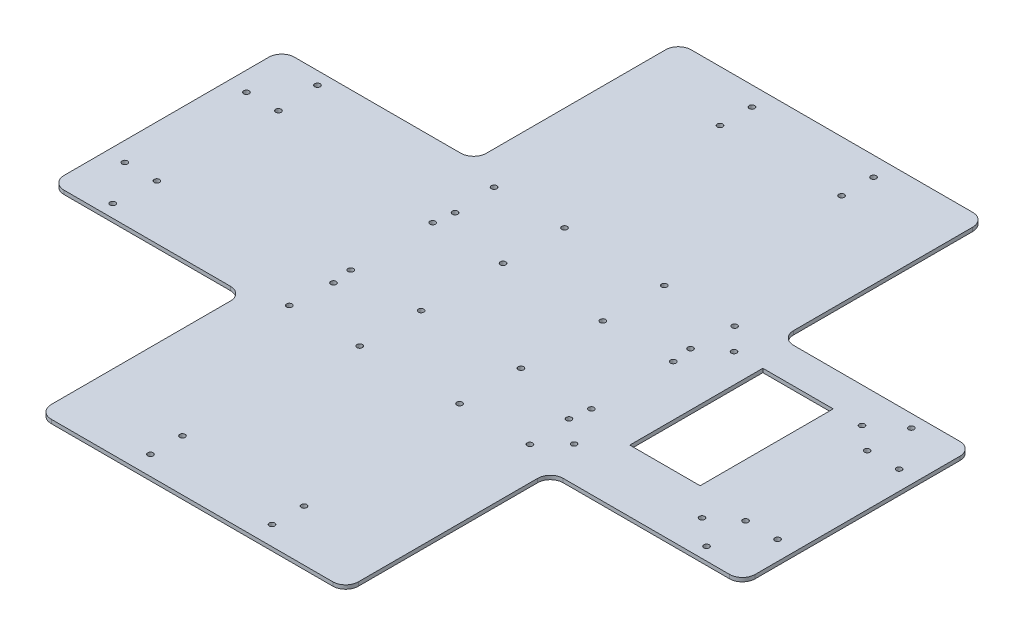
from build123d import *

# Parameters (mm, degrees)
BASE_DEPTH               = 3
FILLET1_R                = 10
SKETCH2_R                = 2.125
ARMOR_MODULE_HOLES_DEPTH = 3
SKETCH3_R                = 2.125
PLATES_FOR_GIMBAL_DEPTH  = 3
SKETCH6_R                = 2.125
SKETCH6_W                = 55
SKETCH6_H                = 104
BATTERY_MOUNT_DEPTH      = 10
SKETCH5_R                = 2.125
SUSPENSION_MOUNT_DEPTH   = 10
SKETCH7_R                = 2.125
CUT_EXTRUDE1_DEPTH       = 10


with BuildPart() as part:
    # Sketch1 → Base (new body)
    with BuildSketch(Plane(origin=(0, 0, 0), x_dir=(1, 0, 0), z_dir=(0, 1, 0))):
        Polygon((120, 250), (-120, 250), (-120, 90), (-270, 90), (-270, -90), (-120, -90), (-120, -250), (120, -250), (120, -90), (270, -90), (270, 90), (120, 90), align=None)
    extrude(amount=BASE_DEPTH)

    # Fillet1
    fillet1_edges = [part.edges().sort_by_distance(p)[0] for p in [
        (120, 1.5, -90),
        (270, 1.5, -90),
        (270, 1.5, 90),
        (120, 1.5, 90),
        (120, 1.5, 250),
        (-120, 1.5, 250),
        (-120, 1.5, 90),
        (-270, 1.5, 90),
        (-270, 1.5, -90),
        (-120, 1.5, -90),
        (-120, 1.5, -250),
        (120, 1.5, -250),
    ]]
    fillet(fillet1_edges, radius=FILLET1_R)

    # Sketch2 → Armor Module Holes (cut)
    with BuildSketch(Plane(origin=(0, 3, 0), x_dir=(1, 0, 0), z_dir=(0, 1, 0))):
        with Locations((-47.5, 235)):
            Circle(SKETCH2_R)
        with Locations((-47.5, 210)):
            Circle(SKETCH2_R)
        with Locations((-255, 47.5)):
            Circle(SKETCH2_R)
        with Locations((-230, 47.5)):
            Circle(SKETCH2_R)
        with Locations((-230, -47.5)):
            Circle(SKETCH2_R)
        with Locations((-255, -47.5)):
            Circle(SKETCH2_R)
        with Locations((255, -47.5)):
            Circle(SKETCH2_R)
        with Locations((230, -47.5)):
            Circle(SKETCH2_R)
        with Locations((230, 47.5)):
            Circle(SKETCH2_R)
        with Locations((255, 47.5)):
            Circle(SKETCH2_R)
        with Locations((47.5, 210)):
            Circle(SKETCH2_R)
        with Locations((47.5, 235)):
            Circle(SKETCH2_R)
        with Locations((47.5, -235)):
            Circle(SKETCH2_R)
        with Locations((47.5, -210)):
            Circle(SKETCH2_R)
        with Locations((-47.5, -210)):
            Circle(SKETCH2_R)
        with Locations((-47.5, -235)):
            Circle(SKETCH2_R)
    extrude(amount=-ARMOR_MODULE_HOLES_DEPTH, mode=Mode.SUBTRACT)

    # Sketch3 → Plates for Gimbal (cut)
    with BuildSketch(Plane(origin=(0, 3, 0), x_dir=(1, 0, 0), z_dir=(0, 1, 0))):
        with Locations((92, 47.5)):
            Circle(SKETCH3_R)
        with Locations((92, -47.5)):
            Circle(SKETCH3_R)
        with Locations((-92, -47.5)):
            Circle(SKETCH3_R)
        with Locations((-92, 47.5)):
            Circle(SKETCH3_R)
    extrude(amount=-PLATES_FOR_GIMBAL_DEPTH, mode=Mode.SUBTRACT)

    # Sketch6 → Battery Mount (cut)
    with BuildSketch(Plane(origin=(0, 3, 0), x_dir=(1, 0, 0), z_dir=(0, 1, 0))):
        with Locations((111, -62.5)):
            Circle(SKETCH6_R)
        with Locations((211, -62.5)):
            Circle(SKETCH6_R)
        with Locations((211, 62.5)):
            Circle(SKETCH6_R)
        with Locations((111, 62.5)):
            Circle(SKETCH6_R)
        with Locations((161, 10.5)):
            Rectangle(SKETCH6_W, SKETCH6_H)
    extrude(amount=-BATTERY_MOUNT_DEPTH, mode=Mode.SUBTRACT)

    # Sketch5 → Suspension Mount (cut)
    with BuildSketch(Plane(origin=(0, 3, 0), x_dir=(1, 0, 0), z_dir=(0, 1, 0))):
        with Locations((94, -32)):
            Circle(SKETCH5_R)
        with Locations((94, -80)):
            Circle(SKETCH5_R)
        with Locations((39, -32)):
            Circle(SKETCH5_R)
        with Locations((39, -80)):
            Circle(SKETCH5_R)
        with Locations((-39, -80)):
            Circle(SKETCH5_R)
        with Locations((-39, -32)):
            Circle(SKETCH5_R)
        with Locations((-94, -80)):
            Circle(SKETCH5_R)
        with Locations((-94, -32)):
            Circle(SKETCH5_R)
        with Locations((-94, 32)):
            Circle(SKETCH5_R)
        with Locations((-94, 80)):
            Circle(SKETCH5_R)
        with Locations((-39, 32)):
            Circle(SKETCH5_R)
        with Locations((-39, 80)):
            Circle(SKETCH5_R)
        with Locations((39, 80)):
            Circle(SKETCH5_R)
        with Locations((39, 32)):
            Circle(SKETCH5_R)
        with Locations((94, 80)):
            Circle(SKETCH5_R)
        with Locations((94, 32)):
            Circle(SKETCH5_R)
    extrude(amount=-SUSPENSION_MOUNT_DEPTH, mode=Mode.SUBTRACT)

    # Sketch7 → Cut-Extrude1 (cut)
    with BuildSketch(Plane(origin=(0, 3, 0), x_dir=(1, 0, 0), z_dir=(0, 1, 0))):
        with Locations((-232, -80)):
            Circle(SKETCH7_R)
        with Locations((-232, 80)):
            Circle(SKETCH7_R)
        with Locations((232, 80)):
            Circle(SKETCH7_R)
        with Locations((232, -80)):
            Circle(SKETCH7_R)
    extrude(amount=-CUT_EXTRUDE1_DEPTH, mode=Mode.SUBTRACT)


solid = part.part
